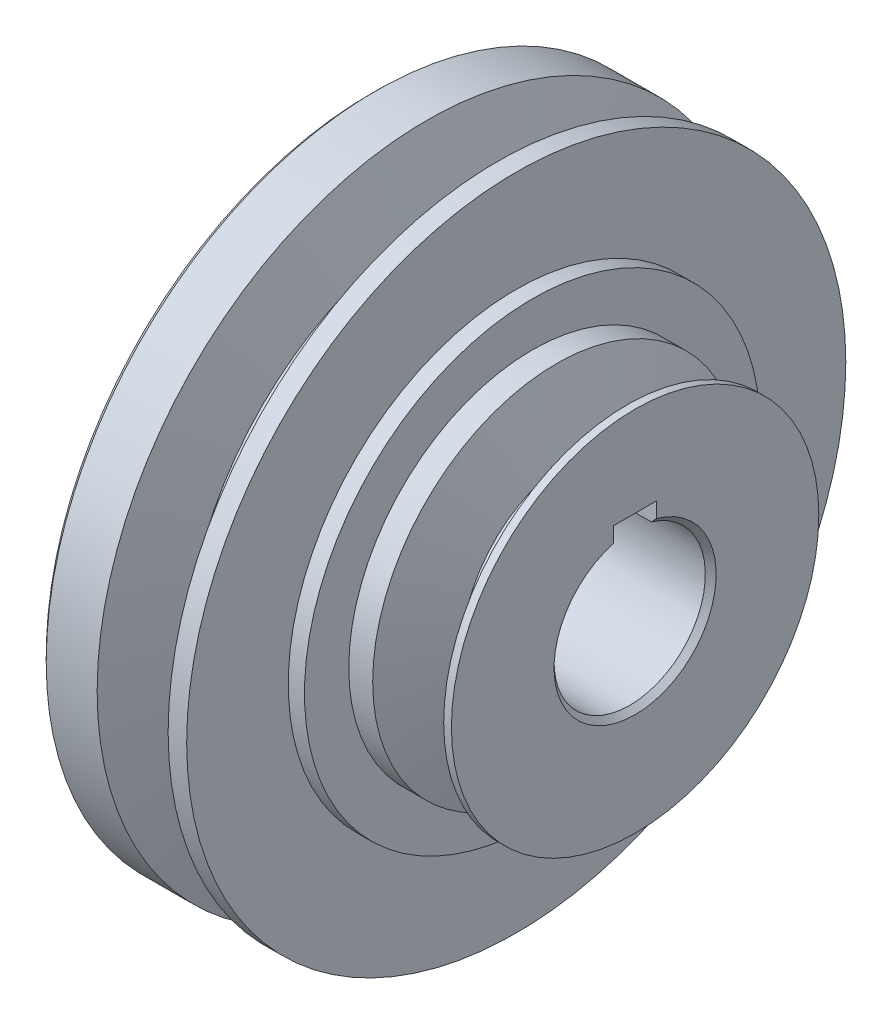
from build123d import *
from build123d.topology import SkipClean

# Parameters (mm, degrees)
EXTRUDE_1_DEPTH         = 10
EXTRUDE_1_DEPTH_BACK    = 17
SKETCH_1_R              = 61
SKETCH_3_R              = 25
EXTRUDE_2_DEPTH         = 19
SKETCH_4_R              = 21
EXTRUDE_3_DEPTH         = 6
SKETCH_5_R              = 16.2
CUT_EXTRUDE_1_DEPTH     = 11
SKETCH_6_R              = 14
CUT_EXTRUDE_2_DEPTH     = 96.514396821
HOLE_WIZARD_M10_1_D     = 8.5
HOLE_WIZARD_M10_1_DEPTH = 17.446342369
HOLE_WIZARD_M10_1_TIP   = 2.553657631
SKETCH_10_R             = 42.19592905
UNDEF_DEPTH             = 3
SKETCH_11_R             = 34
EXTRUDE_5_DEPTH         = 19
CUT_EXTRUDE_3_DEPTH     = 114.657379875
CHAMFER_1_SIZE          = 1


with BuildPart() as part:
    # 草图1 → 凸台-拉伸1 (new, two sides: drawn at the far end of the back side and taken through both)
    with BuildSketch(Plane(origin=(0, 0, 0), x_dir=(0, 0, -1), z_dir=(1, 0, 0)).offset(-EXTRUDE_1_DEPTH_BACK)):
        Circle(SKETCH_1_R)
    extrude(amount=EXTRUDE_1_DEPTH + EXTRUDE_1_DEPTH_BACK)

    # 草图2 → 切除-旋转1 (revolve, cut)
    with BuildSketch(Plane(origin=(0, 0, 0), x_dir=(1, 0, 0), z_dir=(0, 1, 0))):
        Polygon((-6.570057385, 61), (-2.748423867, 48.5), (2.748423867, 48.5), (6.570057385, 61), align=None)
    revolve(axis=Axis((0, 0, 0), (1, 0, 0)), mode=Mode.SUBTRACT)

    # 草图3 → 凸台-拉伸2 (add)
    with BuildSketch(Plane.ZY.offset(17)):
        Circle(SKETCH_3_R)
    extrude(amount=EXTRUDE_2_DEPTH)

    # 草图4 → 凸台-拉伸3 (add)
    with BuildSketch(Plane.ZY.offset(36)):
        Circle(SKETCH_4_R)
    extrude(amount=EXTRUDE_3_DEPTH)

    # 草图5 → 切除-拉伸1 (cut)
    with BuildSketch(Plane.ZY.offset(42)):
        Circle(SKETCH_5_R)
    extrude(amount=-CUT_EXTRUDE_1_DEPTH, mode=Mode.SUBTRACT)

    # 草图6 → 切除-拉伸2 (cut, through all)
    with BuildSketch(Plane.ZY.offset(31)):
        Circle(SKETCH_6_R)
    extrude(amount=-CUT_EXTRUDE_2_DEPTH, mode=Mode.SUBTRACT)

    # M10 螺纹孔1
    with Locations(Plane.ZY.offset(17)):
        with Locations((0, -36.5), (0, 36.5)):
            Hole(HOLE_WIZARD_M10_1_D / 2, depth=HOLE_WIZARD_M10_1_DEPTH)
            with Locations((0, 0, -(HOLE_WIZARD_M10_1_DEPTH + HOLE_WIZARD_M10_1_TIP / 2))):  # 118° drill point
                Cone(0, HOLE_WIZARD_M10_1_D / 2, HOLE_WIZARD_M10_1_TIP, mode=Mode.SUBTRACT)

    # 草图10 → undef (add)
    with BuildSketch(Plane(origin=(10, 0, 0), x_dir=(0, 0, -1), z_dir=(1, 0, 0))):
        Circle(SKETCH_10_R)
    extrude(amount=UNDEF_DEPTH)

    # 草图11 → 凸台-拉伸5 (add)
    with BuildSketch(Plane(origin=(13, 0, 0), x_dir=(0, 0, -1), z_dir=(1, 0, 0))):
        Circle(SKETCH_11_R)
    extrude(amount=EXTRUDE_5_DEPTH)

    # 草图12 → 切除-旋转2 (revolve, cut)
    with BuildSketch(Plane.XY):
        Polygon((21.251576133, 21.5), (26.748423867, 21.5), (30.570057385, 34), (17.429942615, 34), align=None)
    revolve(axis=Axis((0, 0, 0), (1, 0, 0)), mode=Mode.SUBTRACT)

    # 草图7 → 切除-拉伸3 (cut, through all)
    with SkipClean():  # the faces are left unmerged after this step: merging them gives an invalid solid
        with BuildSketch(Plane.ZY.offset(42)):
            with BuildLine():
                Line((-4, 17.3), (4, 17.3))
                Line((4, 17.3), (4, 13.416407865))
                ThreePointArc((4, 13.416407865), (0, -14), (-4, 13.416407865))
                Line((-4, 13.416407865), (-4, 17.3))
            make_face()
        extrude(amount=-CUT_EXTRUDE_3_DEPTH, mode=Mode.SUBTRACT)
    add(part.part.scale(1), mode=Mode.REPLACE)  # the faces are merged on a copy

    # 倒角1
    chamfer_1_edges = [part.edges().sort_by_distance(p)[0] for p in [
        (32, -14, 0),
        (-17, 0, 61),
    ]]
    chamfer(chamfer_1_edges, length=CHAMFER_1_SIZE)


solid = part.part
